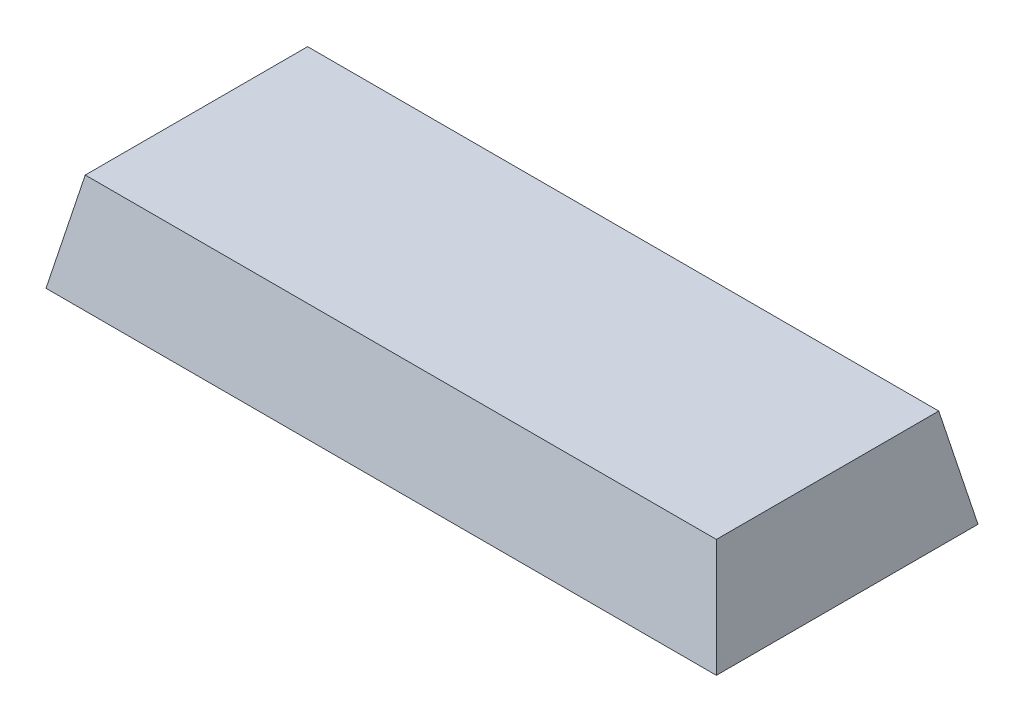
from build123d import *

# Parameters (mm, degrees)
SKETCH1_W               = 20.5
SKETCH1_H               = 8
BOSS_EXTRUDE1_DEPTH     = 3
CUT_EXTRUDE1_DEPTH      = 23.209232315
CUT_EXTRUDE1_DEPTH_BACK = 23.209232315
CUT_EXTRUDE2_DEPTH      = 23.209232315
CUT_EXTRUDE2_DEPTH_BACK = 23.209232315
SKETCH4_R               = 1.8
CUT_EXTRUDE3_DEPTH      = 0.8
SKETCH5_W               = 8
SKETCH5_H               = 1.1
BOSS_EXTRUDE2_DEPTH     = 2
FILLET1_R               = 4


with BuildPart() as part:
    # Sketch1 → Boss-Extrude1 (new body)
    with BuildSketch(Plane(origin=(0, 0, 0), x_dir=(1, 0, 0), z_dir=(0, 1, 0))):
        with Locations((10.25, 4)):
            Rectangle(SKETCH1_W, SKETCH1_H)
    extrude(amount=BOSS_EXTRUDE1_DEPTH)

    # Sketch2 → Cut-Extrude1 (cut, two sides: drawn at the far end of the back side and taken through both)
    with BuildSketch(Plane.XY.offset(-CUT_EXTRUDE1_DEPTH_BACK)):
        Polygon((0, 0), (0.6, 3), (0, 3), align=None)
        Polygon((20.5, 0), (19.9, 3), (20.5, 3), align=None)
    extrude(amount=CUT_EXTRUDE1_DEPTH + CUT_EXTRUDE1_DEPTH_BACK, mode=Mode.SUBTRACT)

    # Sketch3 → Cut-Extrude2 (cut, two sides: drawn at the far end of the back side and taken through both)
    with BuildSketch(Plane(origin=(0, 0, 0), x_dir=(0, 0, -1), z_dir=(1, 0, 0)).offset(-CUT_EXTRUDE2_DEPTH_BACK)):
        Polygon((0, 0), (0.6, 3), (0, 3), align=None)
        Polygon((8, 3), (7.4, 3), (8, 0), align=None)
    extrude(amount=CUT_EXTRUDE2_DEPTH + CUT_EXTRUDE2_DEPTH_BACK, mode=Mode.SUBTRACT)

    # Sketch4 → Cut-Extrude3 (cut)
    with BuildSketch(Plane.XZ):
        with Locations(Location((10.25000125, -3.75, 0), (0, 0, 270))):
            Circle(SKETCH4_R)
    extrude(amount=-CUT_EXTRUDE3_DEPTH, mode=Mode.SUBTRACT)

    # Sketch5 → Boss-Extrude2 (add)
    with BuildSketch(Plane.XZ):
        with Locations((10.250011, -7.45)):
            Rectangle(SKETCH5_W, SKETCH5_H)
    extrude(amount=BOSS_EXTRUDE2_DEPTH)

    # Fillet1
    # the kernel refuses this fillet: 4 mm, written as the material it takes off along each edge
    with BuildSketch(Plane(origin=(14.250011, -2, -16.660254038), x_dir=(0, 1, 0), z_dir=(0, 0, 1)), Plane(origin=(6.250011, -2, 1.760254038), x_dir=(0, 1, 0), z_dir=(0, 0, -1))) as fillet1_piece_1:
        with BuildLine():
            CenterArc((4, 3.464101615), FILLET1_R, 180, 60)
            Line((0, 3.464101615), (-0.08, 3.464101615))
            Line((-0.08, 3.464101615), (-0.08, 0))
            Line((-0.08, 0), (0, -0.08))
            ThreePointArc((0, -0.08), (1, -0.08), (1.96, -0.069282032))
            Line((1.96, -0.069282032), (2, 0))
        make_face()
    extrude(amount=18.420508076, mode=Mode.SUBTRACT)


solid = part.part
